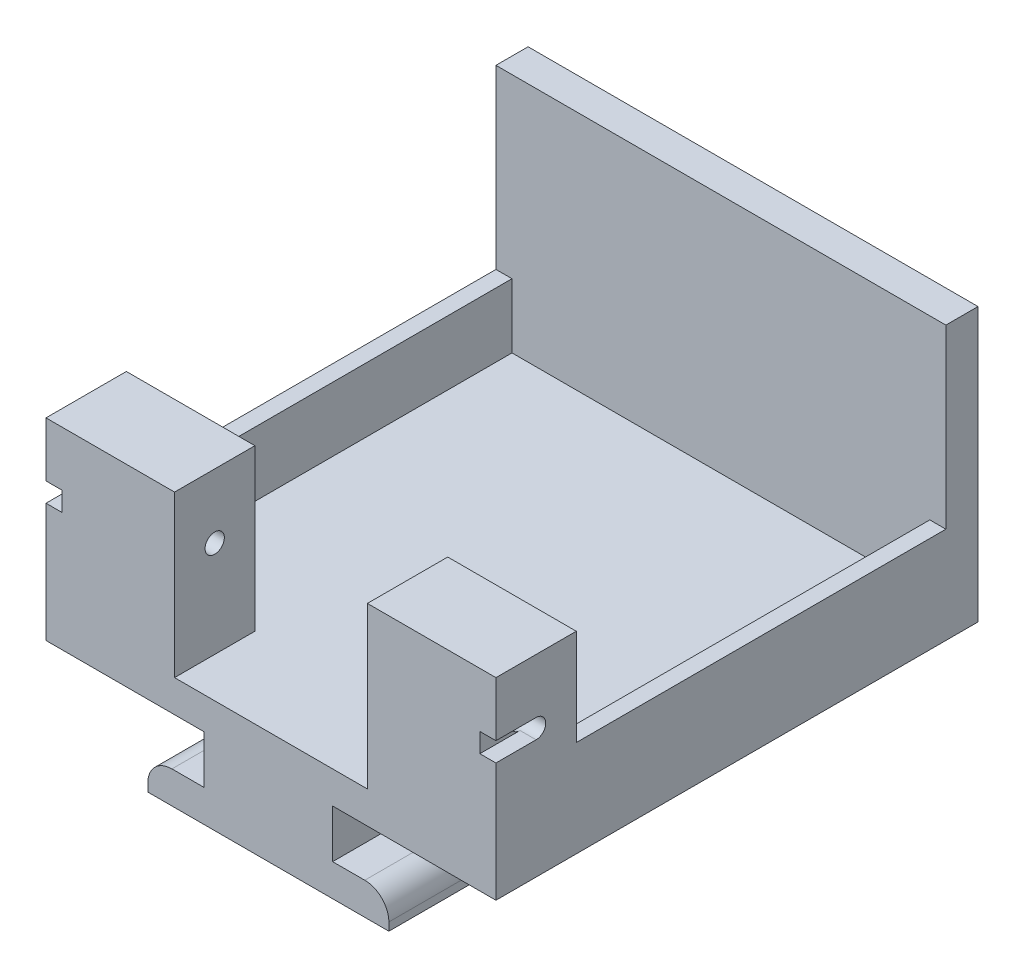
from build123d import *

# Parameters (mm, degrees)
EXTRUDE_1_DEPTH     = 30
FILLET_1_R          = 1.5
SKETCH_2_W          = 8
SKETCH_2_H          = 5
EXTRUDE_2_DEPTH     = 10
SKETCH_3_R          = 0.6
CUT_EXTRUDE_1_DEPTH = 43.316951242
EXTRUDE_4_DEPTH     = 15
SKETCH_8_W          = 2.5
SKETCH_8_H          = 1.2
CUT_EXTRUDE_3_DEPTH = 1
SKETCH_9_W          = 2.5
SKETCH_9_H          = 1.2
CUT_EXTRUDE_4_DEPTH = 1
SKETCH_6_W          = 1
SKETCH_6_H          = 23
EXTRUDE_6_DEPTH     = 4


with BuildPart() as part:
    # 草图1 → 凸台-拉伸1 (new body)
    with BuildSketch(Plane.XY):
        Polygon((-13.927970183, -1.669251604), (-4.090414819, -1.669251604), (-4.090414819, -4.669251604), (-7.590414819, -4.669251604), (-7.590414819, -6.669251604), (7.409585181, -6.669251604), (7.409585181, -4.669251604), (3.909585181, -4.669251604), (3.909585181, -1.669251604), (14.072029817, -1.669251604), (14.072029817, 0.330748396), (-13.927970183, 0.330748396), align=None)
    extrude(amount=EXTRUDE_1_DEPTH)

    # 圆角1
    fillet_1_edges = [part.edges().sort_by_distance(p)[0] for p in [
        (-7.590414819, -4.669251604, 15),
        (7.409585181, -4.669251604, 15),
    ]]
    fillet(fillet_1_edges, radius=FILLET_1_R)

    # 草图2 → 凸台-拉伸2 (add)
    with BuildSketch(Plane(origin=(0, 0.330748396, 0), x_dir=(1, 0, 0), z_dir=(0, 1, 0))):
        with Locations((-9.927970183, -27.5)):
            Rectangle(SKETCH_2_W, SKETCH_2_H)
        with Locations((10.072029817, -27.5)):
            Rectangle(SKETCH_2_W, SKETCH_2_H)
    extrude(amount=EXTRUDE_2_DEPTH)

    # 草图3 → 切除-拉伸1 (cut, through all)
    with BuildSketch(Plane.ZY.offset(13.927970183)):
        with Locations((27.5, 6.330748396)):
            Circle(SKETCH_3_R)
    extrude(amount=-CUT_EXTRUDE_1_DEPTH, mode=Mode.SUBTRACT)

    # 草图4 → 凸台-拉伸4 (add)
    with BuildSketch(Plane(origin=(0, 0.330748396, 0), x_dir=(1, 0, 0), z_dir=(0, 1, 0))):
        Polygon((14.072029817, 0), (-13.927970183, 0), (-13.927970183, -2), (13.072029817, -2), (14.072029817, -2), align=None)
    extrude(amount=EXTRUDE_4_DEPTH)

    # 草图8 → 切除-拉伸3 (cut)
    with BuildSketch(Plane.ZY.offset(13.927970183)):
        with Locations((28.75, 6.330748396)):
            Rectangle(SKETCH_8_W, SKETCH_8_H)
    extrude(amount=-CUT_EXTRUDE_3_DEPTH, mode=Mode.SUBTRACT)

    # 草图9 → 切除-拉伸4 (cut)
    with BuildSketch(Plane(origin=(14.072029817, 0, 0), x_dir=(0, 0, -1), z_dir=(1, 0, 0))):
        with Locations((-28.75, 6.330748396)):
            Rectangle(SKETCH_9_W, SKETCH_9_H)
    extrude(amount=-CUT_EXTRUDE_4_DEPTH, mode=Mode.SUBTRACT)

    # 草图6 → 凸台-拉伸6 (add)
    with BuildSketch(Plane(origin=(0, 0.330748396, 0), x_dir=(1, 0, 0), z_dir=(0, 1, 0))):
        with Locations((-13.427970183, -13.5)):
            Rectangle(SKETCH_6_W, SKETCH_6_H)
        with Locations((13.572029817, -13.5)):
            Rectangle(SKETCH_6_W, SKETCH_6_H)
    extrude(amount=EXTRUDE_6_DEPTH)


solid = part.part
